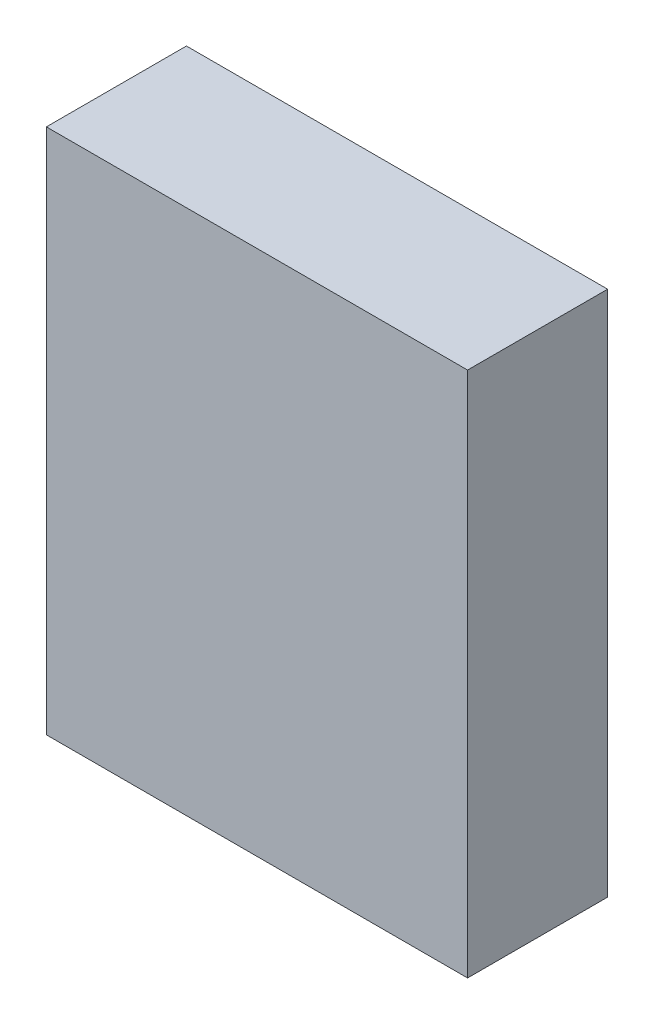
from build123d import *

# Parameters (mm, degrees)
SKETCH1_W           = 400
SKETCH1_H           = 500
BOSS_EXTRUDE1_DEPTH = 150
SKETCH2_W           = 400
SKETCH2_H           = 500
SKETCH2_W_2         = 355
SKETCH2_H_2         = 460
CUT_EXTRUDE1_DEPTH  = 17
SHELL1_T            = -1.5
SKETCH3_R           = 7.5
BOSS_EXTRUDE2_DEPTH = 14
SKETCH4_R           = 3
BOSS_EXTRUDE3_DEPTH = 12.5


with BuildPart() as part:
    # Sketch1 → Boss-Extrude1 (new body)
    with BuildSketch(Plane.XY):
        Rectangle(SKETCH1_W, SKETCH1_H)
    extrude(amount=BOSS_EXTRUDE1_DEPTH)

    # Sketch2 → Cut-Extrude1 (cut)
    with BuildSketch(Plane(origin=(0, 0, 0), x_dir=(-1, 0, 0), z_dir=(0, 0, -1))):
        Rectangle(SKETCH2_W, SKETCH2_H)
        Rectangle(SKETCH2_W_2, SKETCH2_H_2, mode=Mode.SUBTRACT)
    extrude(amount=-CUT_EXTRUDE1_DEPTH, mode=Mode.SUBTRACT)

    # Shell1
    shell1_openings = [part.faces().sort_by_distance(p)[0] for p in [
        (0, 0, 0),
    ]]
    offset(amount=SHELL1_T, openings=shell1_openings, kind=Kind.INTERSECTION)

    # Sketch3 → Boss-Extrude2 (add)
    with BuildSketch(Plane(origin=(0, 0, 148.5), x_dir=(-1, 0, 0), z_dir=(0, 0, -1))):
        with Locations((-162.5, 202.5)):
            Circle(SKETCH3_R)
        with Locations((162.5, 202.5)):
            Circle(SKETCH3_R)
        with Locations((162.5, -202.5)):
            Circle(SKETCH3_R)
        with Locations((-162.5, -202.5)):
            Circle(SKETCH3_R)
    extrude(amount=BOSS_EXTRUDE2_DEPTH)

    # Sketch4 → Boss-Extrude3 (add)
    with BuildSketch(Plane.ZY.offset(-198.5)):
        with Locations((43.5, -188.5)):
            Circle(SKETCH4_R)
    extrude(amount=BOSS_EXTRUDE3_DEPTH)


solid = part.part
